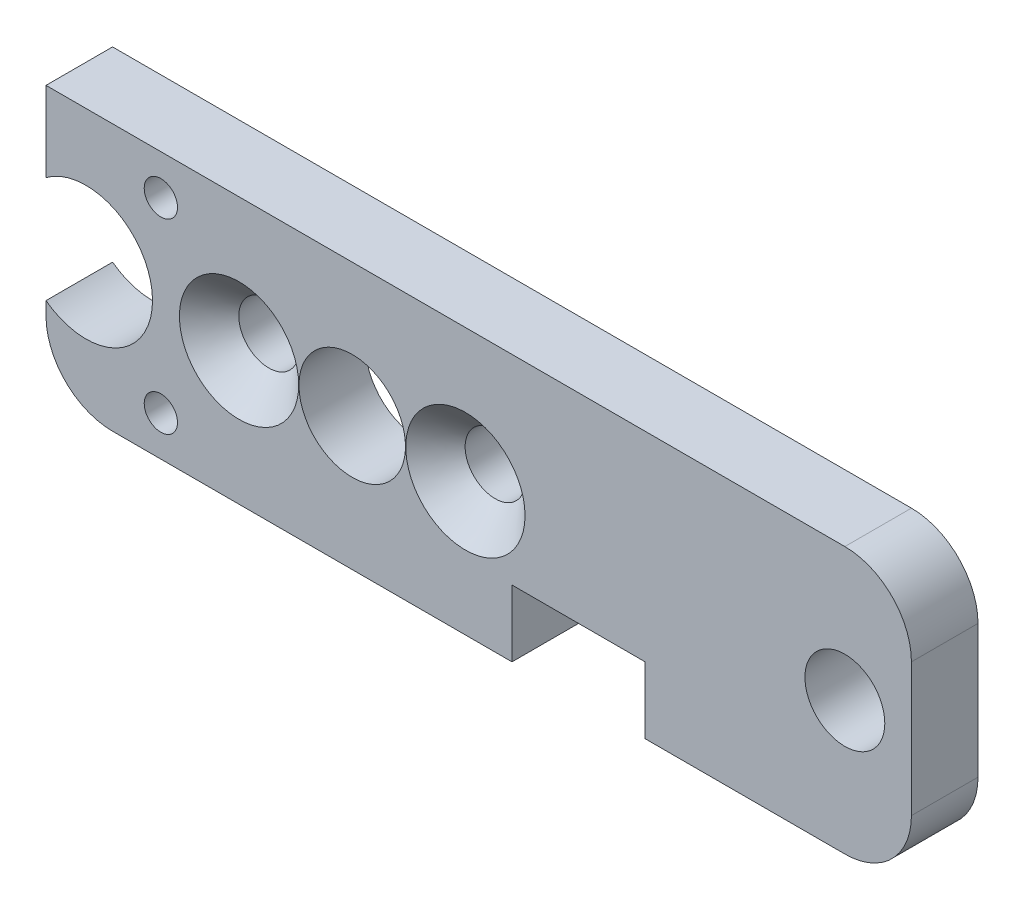
from build123d import *

# Parameters (mm, degrees)
SKETCH1_W                                            = 65
SKETCH1_H                                            = 20
BOSS_EXTRUDE1_DEPTH                                  = 5
F_10_0MM_DOWEL_HOLE1_D                               = 10
F_10_0MM_DOWEL_HOLE1_DEPTH                           = 25
F_10_0MM_DOWEL_HOLE1_TIP                             = 3.004303095
CSK_FOR_M4_HEX_SOCKET_COUNTERSUNK_CAP_SC_D           = 4.5
CSK_FOR_M4_HEX_SOCKET_COUNTERSUNK_CAP_SC_CSINK_D     = 8.96
CSK_FOR_M4_HEX_SOCKET_COUNTERSUNK_CAP_SC_CSINK_ANGLE = 90
F_6_0MM_DOWEL_HOLE1_D                                = 6
F_6_0MM_DOWEL_HOLE1_DEPTH                            = 25
F_6_0MM_DOWEL_HOLE1_TIP                              = 1.802581857
F_4_0MM_DOWEL_HOLE2_D                                = 4
F_4_0MM_DOWEL_HOLE2_DEPTH                            = 25
F_4_0MM_DOWEL_HOLE2_TIP                              = 1.201721238
F_8_0MM_DOWEL_HOLE1_D                                = 8
F_8_0MM_DOWEL_HOLE1_DEPTH                            = 5
F_8_0MM_DOWEL_HOLE1_TIP                              = 2.403442476
SKETCH22_W                                           = 10
SKETCH22_H                                           = 5
CUT_EXTRUDE1_DEPTH                                   = 10
M2_TAPPED_HOLE2_D                                    = 1.6
M2_TAPPED_HOLE2_DEPTH                                = 7
M2_TAPPED_HOLE2_TIP                                  = 0.480688495
FILLET1_R                                            = 5
M3_TAPPED_HOLE2_D                                    = 2.5
M3_TAPPED_HOLE2_DEPTH                                = 7.5
M3_TAPPED_HOLE2_TIP                                  = 0.751075774


with BuildPart() as part:
    # Sketch1 → Boss-Extrude1 (new body)
    with BuildSketch(Plane.XY):
        with Locations((5.197000354, -2.580625299)):
            Rectangle(SKETCH1_W, SKETCH1_H)
    extrude(amount=BOSS_EXTRUDE1_DEPTH)

    # Ø10.0mm Dowel Hole1
    with Locations(Plane(origin=(-24.302999646, -2.580625299, 5), x_dir=(1, 0, 0), z_dir=(0, 0, 1))):
        with Locations((0, 0)):
            Hole(F_10_0MM_DOWEL_HOLE1_D / 2, depth=F_10_0MM_DOWEL_HOLE1_DEPTH)
            with Locations((0, 0, -(F_10_0MM_DOWEL_HOLE1_DEPTH + F_10_0MM_DOWEL_HOLE1_TIP / 2))):  # 118° drill point
                Cone(0, F_10_0MM_DOWEL_HOLE1_D / 2, F_10_0MM_DOWEL_HOLE1_TIP, mode=Mode.SUBTRACT)

    # CSK for M4 Hex Socket Countersunk Cap Screw1 (through all)
    with Locations(Plane(origin=(-12.802999646, -2.580625299, 5), x_dir=(1, 0, 0), z_dir=(0, 0, 1))):
        with Locations((0, 0), (17, 0)):
            CounterSinkHole(CSK_FOR_M4_HEX_SOCKET_COUNTERSUNK_CAP_SC_D / 2, CSK_FOR_M4_HEX_SOCKET_COUNTERSUNK_CAP_SC_CSINK_D / 2, counter_sink_angle=CSK_FOR_M4_HEX_SOCKET_COUNTERSUNK_CAP_SC_CSINK_ANGLE)

    # Ø6.0mm Dowel Hole1
    with Locations(Plane(origin=(32.697000354, -2.580625299, 5), x_dir=(1, 0, 0), z_dir=(0, 0, 1))):
        with Locations((0, 0)):
            Hole(F_6_0MM_DOWEL_HOLE1_D / 2, depth=F_6_0MM_DOWEL_HOLE1_DEPTH)
            with Locations((0, 0, -(F_6_0MM_DOWEL_HOLE1_DEPTH + F_6_0MM_DOWEL_HOLE1_TIP / 2))):  # 118° drill point
                Cone(0, F_6_0MM_DOWEL_HOLE1_D / 2, F_6_0MM_DOWEL_HOLE1_TIP, mode=Mode.SUBTRACT)

    # Ø4.0mm Dowel Hole2
    with Locations(Plane(origin=(-4.302999646, -2.580625299, 0), x_dir=(-1, 0, 0), z_dir=(0, 0, -1))):
        with Locations((0, 0)):
            Hole(F_4_0MM_DOWEL_HOLE2_D / 2, depth=F_4_0MM_DOWEL_HOLE2_DEPTH)
            with Locations((0, 0, -(F_4_0MM_DOWEL_HOLE2_DEPTH + F_4_0MM_DOWEL_HOLE2_TIP / 2))):  # 118° drill point
                Cone(0, F_4_0MM_DOWEL_HOLE2_D / 2, F_4_0MM_DOWEL_HOLE2_TIP, mode=Mode.SUBTRACT)

    # Ø8.0mm Dowel Hole1
    with Locations(Plane(origin=(-4.302999646, -2.580625299, 0), x_dir=(-1, 0, 0), z_dir=(0, 0, -1))):
        with Locations((0, 0)):
            Hole(F_8_0MM_DOWEL_HOLE1_D / 2, depth=F_8_0MM_DOWEL_HOLE1_DEPTH)
            with Locations((0, 0, -(F_8_0MM_DOWEL_HOLE1_DEPTH + F_8_0MM_DOWEL_HOLE1_TIP / 2))):  # 118° drill point
                Cone(0, F_8_0MM_DOWEL_HOLE1_D / 2, F_8_0MM_DOWEL_HOLE1_TIP, mode=Mode.SUBTRACT)

    # Sketch22 → Cut-Extrude1 (cut)
    with BuildSketch(Plane(origin=(0, 0, 0), x_dir=(-1, 0, 0), z_dir=(0, 0, -1))):
        with Locations((-12.697000354, -10.080625299)):
            Rectangle(SKETCH22_W, SKETCH22_H)
    extrude(amount=-CUT_EXTRUDE1_DEPTH, mode=Mode.SUBTRACT)

    # M2 Tapped Hole2
    with Locations(Plane(origin=(12.697000354, -7.580625299, 2.5), x_dir=(-1, 0, 0), z_dir=(0, -1, 0))):
        with Locations((0, 0)):
            Hole(M2_TAPPED_HOLE2_D / 2, depth=M2_TAPPED_HOLE2_DEPTH)
            with Locations((0, 0, -(M2_TAPPED_HOLE2_DEPTH + M2_TAPPED_HOLE2_TIP / 2))):  # 118° drill point
                Cone(0, M2_TAPPED_HOLE2_D / 2, M2_TAPPED_HOLE2_TIP, mode=Mode.SUBTRACT)

    # Fillet1
    fillet1_edges = [part.edges().sort_by_distance(p)[0] for p in [
        (37.697000354, 7.419374701, 2.5),
        (37.697000354, -12.580625299, 2.5),
        (-27.302999646, -12.580625299, 2.5),
    ]]
    fillet(fillet1_edges, radius=FILLET1_R)

    # M3 Tapped Hole2
    with Locations(Plane(origin=(-18.67644652, 4.419374701, 0), x_dir=(-1, 0, 0), z_dir=(0, 0, -1))):
        with Locations((0, 0), (0, -14)):
            Hole(M3_TAPPED_HOLE2_D / 2, depth=M3_TAPPED_HOLE2_DEPTH)
            with Locations((0, 0, -(M3_TAPPED_HOLE2_DEPTH + M3_TAPPED_HOLE2_TIP / 2))):  # 118° drill point
                Cone(0, M3_TAPPED_HOLE2_D / 2, M3_TAPPED_HOLE2_TIP, mode=Mode.SUBTRACT)


solid = part.part
